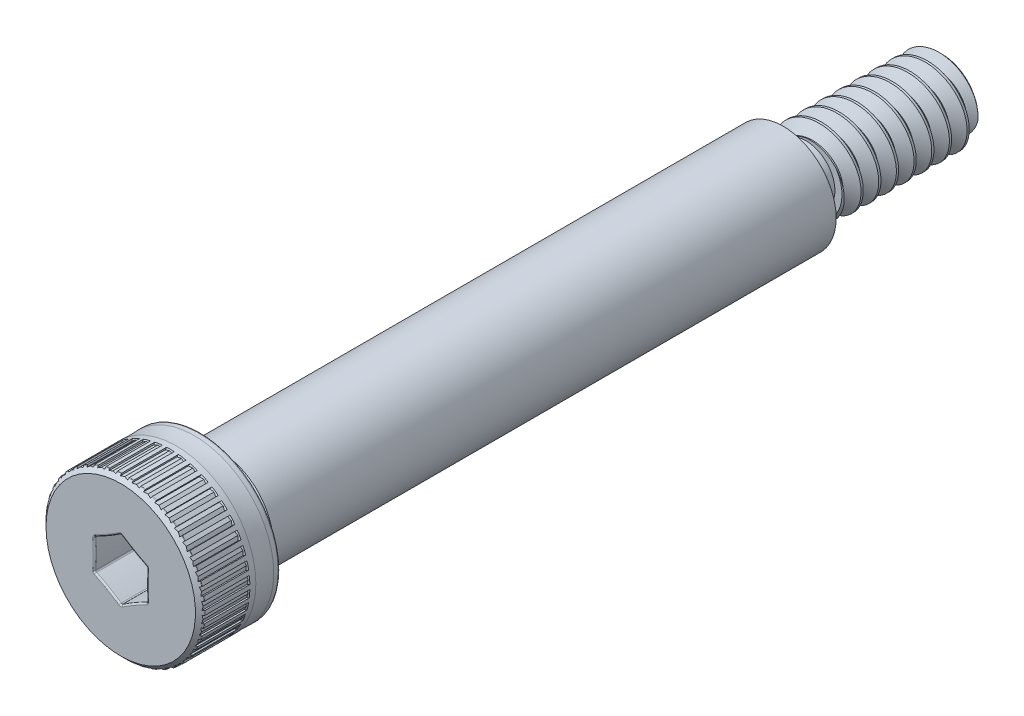
from build123d import *

# Parameters (mm, degrees)
SKETCH4_W             = 1.190625
SKETCH4_H             = 0.3175
SKETCH4_W_2           = 1.375833333
SKETCH4_H_2           = 0.687407664
CHAMFER1_SIZE         = 0.3175
FILLET1_R             = 0.1905
FILLET2_R             = 0.211666667
CHAMFER2_SIZE         = 0.264583333
CHAMFER3_SIZE         = 0.28575
CUT_EXTRUDE1_DEPTH    = 2.413
FILLET4_R             = 0.09525
DELETEFACE1_START     = -36.300833333
DELETEFACE1_OUTLINE_W = 6
DELETEFACE1_OUTLINE_H = 6
DELETEFACE1_OUTLINE_R = 1.725592336
DELETEFACE1_DEPTH     = 0.211666766
CUT_SWEEP1_PITCH      = 1.058333333
CUT_EXTRUDE2_REACH    = 51.671
CIRPATTERN1_COUNT     = 42
FILLET5_R             = 0.0508


# Read off the part's stored shape, not the designer's step: DeleteFace1, CirPattern2
with BuildPart() as part:
    # Sketch3 → Revolve1 (revolve)
    with BuildSketch(Plane(origin=(0, 0, 0), x_dir=(0, 0, -1), z_dir=(1, 0, 0)), mode=Mode.PRIVATE) as revolve1_sk:
        Polygon((-4.7625, 4.7625), (0, 4.7625), (0, 3.175), (34.925, 3.175), (34.925, 2.413), (44.45, 2.413), (44.45, 0), (-4.7625, 0), align=None)
    revolve(revolve1_sk.sketch.rotate(Axis((0, 0, 4.7625), (0, 0, -1)), 90), axis=Axis((0, 0, 4.7625), (0, 0, -1)))

    # Sketch4 → Cut-Revolve1 (revolve, cut)
    with BuildSketch(Plane(origin=(0, 0, 0), x_dir=(0, 0, -1), z_dir=(1, 0, 0)), mode=Mode.PRIVATE) as cut_revolve1_sk:
        with Locations((0.5953125, 3.01625)):
            Rectangle(SKETCH4_W, SKETCH4_H)
        with Locations((35.612916666, 2.069296168)):
            Rectangle(SKETCH4_W_2, SKETCH4_H_2)
    revolve(cut_revolve1_sk.sketch.rotate(Axis((0, 0, 4.7625), (0, 0, -1)), 90), axis=Axis((0, 0, 4.7625), (0, 0, -1)), mode=Mode.SUBTRACT)

    # Chamfer1
    chamfer1_edges = [part.edges().sort_by_distance(p)[0] for p in [
        (-2.8575, 0, -1.190625),
    ]]
    chamfer(chamfer1_edges, length=CHAMFER1_SIZE - 0.0001)  # a hair under: the kernel refuses the full size

    # Fillet1
    fillet1_edges = [part.edges().sort_by_distance(p)[0] for p in [
        (-2.8575, 0, 0),
    ]]
    fillet(fillet1_edges, radius=FILLET1_R)

    # Fillet2
    fillet2_edges = [part.edges().sort_by_distance(p)[0] for p in [
        (-1.725592336, 0, -34.925),
        (-1.725592336, 0, -36.300833333),
    ]]
    fillet(fillet2_edges, radius=FILLET2_R)

    # Chamfer2
    chamfer2_edges = [part.edges().sort_by_distance(p)[0] for p in [
        (-2.413, 0, -36.300833333),
        (-2.413, 0, -44.45),
    ]]
    chamfer(chamfer2_edges, length=CHAMFER2_SIZE)

    # Chamfer3
    chamfer3_edges = [part.edges().sort_by_distance(p)[0] for p in [
        (-4.7625, 0, 4.7625),
    ]]
    chamfer(chamfer3_edges, length=CHAMFER3_SIZE)

    # Sketch5 → Cut-Extrude1 (cut)
    with BuildSketch(Plane.XY.offset(4.7625)):
        with BuildLine():
            ThreePointArc((1.5875, 0.916543552), (0.777875, 1.347319022), (0, 1.833087105))
            ThreePointArc((0, 1.833087105), (-0.777875, 1.347319022), (-1.5875, 0.916543552))
            ThreePointArc((-1.5875, 0.916543552), (-1.55575, 0), (-1.5875, -0.916543552))
            ThreePointArc((-1.5875, -0.916543552), (-0.777875, -1.347319022), (0, -1.833087105))
            ThreePointArc((0, -1.833087105), (0.777875, -1.347319022), (1.5875, -0.916543552))
            ThreePointArc((1.5875, -0.916543552), (1.55575, 0), (1.5875, 0.916543552))
        make_face()
    extrude(amount=-CUT_EXTRUDE1_DEPTH, mode=Mode.SUBTRACT)

    # Fillet4
    fillet4_edges = [part.edges().sort_by_distance(p)[0] for p in [
        (1.55575, 0, 2.3495),
        (1.5875, 0.916543552, 3.556),
        (0.777875, -1.347319022, 2.3495),
        (1.5875, -0.916543552, 3.556),
        (-0.777875, -1.347319022, 2.3495),
        (0, -1.833087105, 3.556),
        (-1.55575, 0, 2.3495),
        (-1.5875, -0.916543552, 3.556),
        (-0.777875, 1.347319022, 2.3495),
        (-1.5875, 0.916543552, 3.556),
        (0.777875, 1.347319022, 2.3495),
        (0, 1.833087105, 3.556),
        (1.55575, 0, 4.7625),
        (0.777875, 1.347319022, 4.7625),
        (-0.777875, 1.347319022, 4.7625),
        (-1.55575, 0, 4.7625),
        (-0.777875, -1.347319022, 4.7625),
        (0.777875, -1.347319022, 4.7625),
        (-4.7625, 0, 0),
    ]]
    fillet(fillet4_edges, radius=FILLET4_R)

    # DeleteFace1 outline → DeleteFace1 (cut)
    with BuildSketch(Plane.XY.offset(DELETEFACE1_START)):
        Rectangle(DELETEFACE1_OUTLINE_W, DELETEFACE1_OUTLINE_H)
        Circle(DELETEFACE1_OUTLINE_R, mode=Mode.SUBTRACT)
    extrude(amount=DELETEFACE1_DEPTH, mode=Mode.SUBTRACT)

    # Cut-Sweep1: the profile of Sketch7 profile screwed along a right-hand helix of 8.48 turns, 8 arcs to a turn; built about Z, then put on its axis
    cut_sweep1_z = Axis((0, 0, 0), (0, 0, 1))
    cut_sweep1_corners = [(2.470283972, 0, 0.033072917), (2.470283972, 0, -0.959114583), (1.725292336, 0, -0.528993462), (1.725292336, 0, -0.397048205)]
    with BuildLine(mode=Mode.PRIVATE) as cut_sweep1_profile:
        Line(cut_sweep1_corners[0], cut_sweep1_corners[1])
        Line(cut_sweep1_corners[1], cut_sweep1_corners[2])
        Line(cut_sweep1_corners[2], cut_sweep1_corners[3])
        Line(cut_sweep1_corners[3], cut_sweep1_corners[0])
    cut_sweep1_cap = Face(cut_sweep1_profile.wire())
    cut_sweep1_turn_angles = [0, 22.5, 45, 67.5, 90, 112.5, 135, 157.5, 180, 202.5, 225, 247.5, 270, 292.5, 315, 337.5, 360]
    cut_sweep1_turn_weights = [1, 0.9238795325112867, 1, 0.9238795325112867, 1, 0.9238795325112867, 1, 0.9238795325112867, 1, 0.9238795325112867, 1, 0.9238795325112867, 1, 0.9238795325112867, 1, 0.9238795325112867, 1]
    cut_sweep1_turn_rails = [Edge.make_bspline([Vector(p[0], p[1], 0).rotate(cut_sweep1_z, cut_sweep1_turn_angles[k]) / cut_sweep1_turn_weights[k] + Vector(0, 0, p[2] + CUT_SWEEP1_PITCH * cut_sweep1_turn_angles[k] / 360) for k in range(17)], [0, 0, 0, 1, 1, 2, 2, 3, 3, 4, 4, 5, 5, 6, 6, 7, 7, 8, 8, 8], 2, cut_sweep1_turn_weights) for p in cut_sweep1_corners]
    cut_sweep1_turn_sides = [Face.make_surface_from_curves(cut_sweep1_turn_rails[p[0]], cut_sweep1_turn_rails[p[1]]) for p in [(0, 1), (1, 2), (2, 3), (3, 0)]]
    cut_sweep1_last_angles = [2880, 2902.5, 2925, 2947.5, 2970, 2992.5, 3015, 3033.899999987, 3052.799999974]
    cut_sweep1_last_weights = [1, 0.9238795325112867, 1, 0.9238795325112867, 1, 0.9238795325112867, 1, 0.9460853588998135, 1]
    cut_sweep1_last_rails = [Edge.make_bspline([Vector(p[0], p[1], 0).rotate(cut_sweep1_z, cut_sweep1_last_angles[k]) / cut_sweep1_last_weights[k] + Vector(0, 0, p[2] + CUT_SWEEP1_PITCH * cut_sweep1_last_angles[k] / 360) for k in range(9)], [0, 0, 0, 1, 1, 2, 2, 3, 3, 4, 4, 4], 2, cut_sweep1_last_weights) for p in cut_sweep1_corners]
    cut_sweep1_last_sides = [Face.make_surface_from_curves(cut_sweep1_last_rails[p[0]], cut_sweep1_last_rails[p[1]]) for p in [(0, 1), (1, 2), (2, 3), (3, 0)]]
    cut_sweep1 = Plane(origin=(0, 0, -44.45), x_dir=(0, 1, 0), z_dir=(0, 0, 1)) * Solid(Shell([*[p.moved(Location((0, 0, CUT_SWEEP1_PITCH * i))) for i in range(8) for p in cut_sweep1_turn_sides], *cut_sweep1_last_sides, cut_sweep1_cap, cut_sweep1_cap.rotate(cut_sweep1_z, 3052.799999974).moved(Location((0, 0, CUT_SWEEP1_PITCH * 3052.799999974 / 360)))]))
    add(cut_sweep1, mode=Mode.SUBTRACT)

    # Cut-Extrude2: up to this plane
    cut_extrude2_end = Plane(origin=(0, 5.814873764, 0.733563736), z_dir=(0, 0.707106781186546, 0.7071067811865491))
    # Sketch8 → Cut-Extrude2 (cut, up to the surface)
    with BuildSketch(Plane.XY.offset(4.7625), mode=Mode.PRIVATE) as cut_extrude2_sk1:
        Polygon((-0.2286, 4.7625), (0.2286, 4.7625), (0.218989269, 4.67106), (0, 4.71678), (-0.218989269, 4.67106), align=None)
    cut_extrude2_tool1 = split(extrude(cut_extrude2_sk1.sketch, amount=-CUT_EXTRUDE2_REACH, mode=Mode.PRIVATE), bisect_by=cut_extrude2_end, keep=Keep.BOTH, mode=Mode.PRIVATE)
    cut_extrude2 = cut_extrude2_tool1.solids().sort_by_distance((0, 4.727084, 4.7625))[0]
    add(cut_extrude2, mode=Mode.SUBTRACT)

    # CirPattern1: Cut-Extrude2 ×42 about axis
    cirpattern1_axis = Axis((0, 0, 0), (0, 0, 1))
    for i in range(1, CIRPATTERN1_COUNT):
        add(cut_extrude2.rotate(cirpattern1_axis, i * 360 / CIRPATTERN1_COUNT), mode=Mode.SUBTRACT)

    # Fillet5
    fillet5_edges = [part.edges().sort_by_distance(p)[0] for p in [
        (0.355902071, 4.749183084, 4.47675),
    ]]
    fillet(fillet5_edges, radius=FILLET5_R)

    # CirPattern2 outline → CirPattern2 (revolve, cut)
    with BuildSketch(Plane.XZ):
        with BuildLine():
            ThreePointArc((4.747621024, 4.491628976), (4.75863308, 4.47514827), (4.7625, 4.455707951))
            Line((4.7625, 4.455707951), (4.7625, 4.491628976))
            Line((4.7625, 4.491628976), (4.747621024, 4.491628976))
        make_face()
    revolve(axis=Axis((0, 0, 0), (0, 0, 1)), mode=Mode.SUBTRACT)

    # Sketch11 → Cut-Revolve6 (revolve, cut)
    with BuildSketch(Plane(origin=(0, 0, 0), x_dir=(0, 0, -1), z_dir=(1, 0, 0)), mode=Mode.PRIVATE) as cut_revolve6_sk:
        with BuildLine():
            Line((-1.42875, 4.7625), (-0.3571875, 4.7625))
            ThreePointArc((-0.3571875, 4.7625), (-0.89296875, 4.74472), (-1.42875, 4.7625))
        make_face()
    revolve(cut_revolve6_sk.sketch.rotate(Axis((0, 0, 4.7625), (0, 0, -1)), 90), axis=Axis((0, 0, 4.7625), (0, 0, -1)), mode=Mode.SUBTRACT)


solid = part.part
